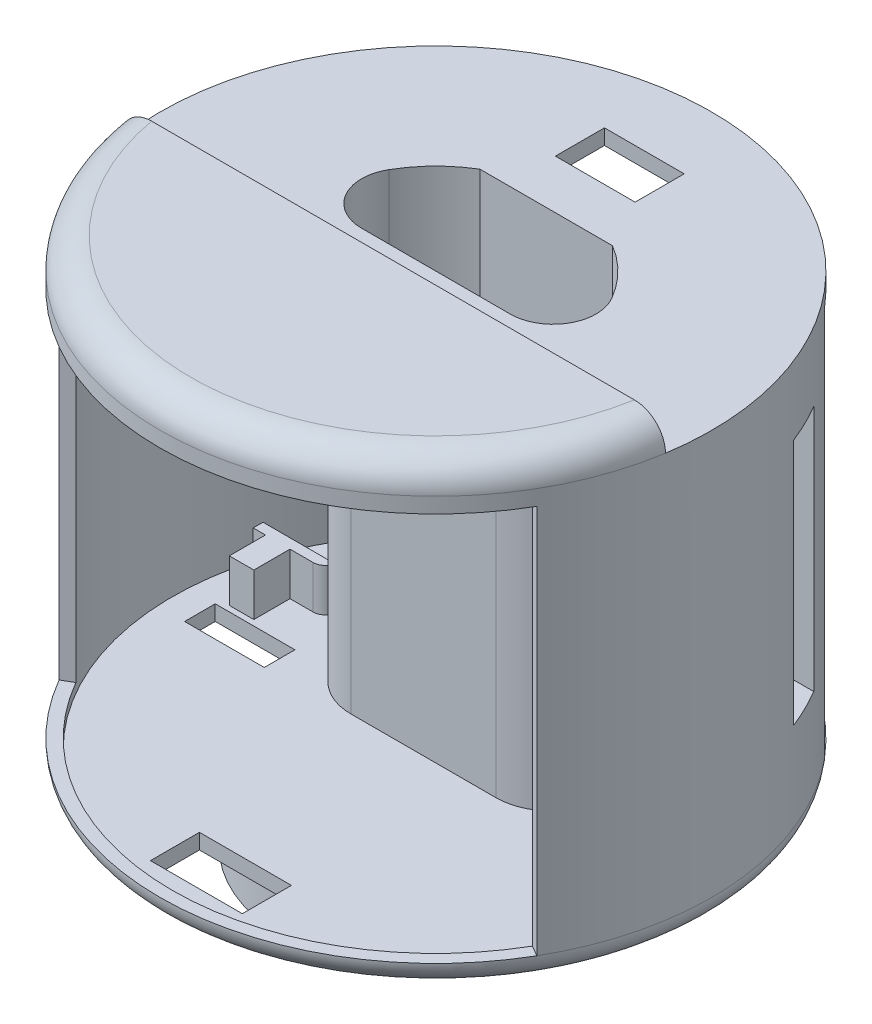
from build123d import *
from build123d.topology import SkipClean

# Parameters (mm, degrees)
CUT_EXTRUDE1_DEPTH           = 5
CUT_EXTRUDE3_DEPTH           = 70
SKETCH8_R                    = 43
CUT_EXTRUDE4_DEPTH           = 65
FILLET1_R                    = 7
SKETCH12_W                   = 6.5
SKETCH12_H                   = 63.5
CUT_REVOLVE1_ANGLE           = 60
CUT_REVOLVE1_OTHER_WAY_ANGLE = 60
SKETCH18_W                   = 13
SKETCH18_H                   = 8
CUT_EXTRUDE13_DEPTH          = 5
SKETCH20_W                   = 100
SKETCH20_H                   = 7
CUT_EXTRUDE15_DEPTH          = 5
SKETCH19_R                   = 1.5
CUT_EXTRUDE14_DEPTH          = 12
FILLET3_R                    = 4
SKETCH24_W                   = 2
SKETCH24_H                   = 3
BOSS_EXTRUDE3_DEPTH          = 2
CIRPATTERN2_COUNT            = 5
SKETCH26_W                   = 5
SKETCH26_H                   = 63.5
CUT_REVOLVE2_ANGLE           = 50
CUT_REVOLVE2_OTHER_WAY_ANGLE = 50
FILLET8_R                    = 9
SKETCH50_W                   = 13
SKETCH50_H                   = 5
CUT_EXTRUDE23_DEPTH          = 7
WRAP1_SECTION_W              = 14
WRAP1_SECTION_H              = 8
WRAP1_ANGLE                  = 29.893450181
SKETCH52_W                   = 21.079035893
SKETCH52_H                   = 8
BOSS_EXTRUDE11_DEPTH         = 7
BOSS_EXTRUDE12_START         = -1
BOSS_EXTRUDE12_OUTLINE_W     = 3
BOSS_EXTRUDE12_OUTLINE_H     = 7
BOSS_EXTRUDE12_DEPTH         = 3
SKETCH54_W                   = 1.6
SKETCH54_H                   = 7
BOSS_EXTRUDE13_DEPTH         = 16
SKETCH55_W                   = 4
SKETCH55_H                   = 7
BOSS_EXTRUDE14_DEPTH         = 6
SKETCH56_W                   = 3
SKETCH56_H                   = 7
CUT_EXTRUDE24_DEPTH          = 1
FILLET9_R                    = 2
SKETCH57_R                   = 1
CUT_EXTRUDE25_DEPTH          = 2
BOSS_EXTRUDE15_START         = 14.3
BOSS_EXTRUDE15_DEPTH         = 3.544129525
BOSS_EXTRUDE15_START_2       = 19.844129625
BOSS_EXTRUDE15_2_DEPTH       = 1.455870375
BOSS_EXTRUDE15_START_3       = 28.5
BOSS_EXTRUDE15_3_DEPTH       = 43.3
BOSS_EXTRUDE15_START_4       = 17.844129525
BOSS_EXTRUDE15_4_DEPTH       = 2.0000001
BOSS_EXTRUDE15_5_DEPTH       = 1.5
BOSS_EXTRUDE15_START_5       = 70.3
BOSS_EXTRUDE15_6_DEPTH       = 1.5
BOSS_EXTRUDE15_START_6       = -10.618295229
BOSS_EXTRUDE15_7_OUTLINE_R   = 1
BOSS_EXTRUDE15_7_DEPTH       = 2
SKETCH63_W                   = 6.5
SKETCH63_H                   = 40.3
CUT_EXTRUDE27_DEPTH          = 10
CUT_EXTRUDE28_DEPTH          = 44
SKETCH67_W                   = 15
SKETCH67_H                   = 8
CUT_EXTRUDE29_DEPTH          = 5


with BuildPart() as part:
    # Sketch1 → Revolve1 (revolve)
    with BuildSketch(Plane.XY, mode=Mode.PRIVATE) as revolve1_sk:
        with BuildLine():
            Line((0, 86.5), (0, 11.5))
            Line((0, 11.5), (22.7, 11.5))
            Line((22.7, 11.5), (22.7, 0))
            Line((22.7, 0), (25, 0))
            Line((25, 0), (25, 11.5))
            Line((25, 11.5), (45, 11.5))
            Line((45, 11.5), (45, 81.5))
            ThreePointArc((45, 81.5), (43.535533906, 85.035533906), (40, 86.5))
            Line((40, 86.5), (0, 86.5))
        make_face()
    revolve(revolve1_sk.sketch.rotate(Axis((0, 2, 0), (0, 1, 0)), 90), axis=Axis((0, 2, 0), (0, 1, 0)))

    # Sketch5 → Cut-Extrude1 (cut)
    with BuildSketch(Plane(origin=(0, 86.5, 0), x_dir=(1, 0, 0), z_dir=(0, 1, 0))):
        with BuildLine():
            Line((-45, 0), (45, 0))
            ThreePointArc((45, 0), (0, 45), (-45, 0))
        make_face()
    extrude(amount=-CUT_EXTRUDE1_DEPTH, mode=Mode.SUBTRACT)

    # Sketch7 → Cut-Extrude3 (cut)
    with BuildSketch(Plane.XZ.offset(-11.5)):
        with BuildLine():
            Line((21, 0), (-21, 0))
            ThreePointArc((-21, 0), (-18.277714988, -10.340461055), (-10.816653826, -18))
            Line((-10.816653826, -18), (10.816653826, -18))
            ThreePointArc((10.816653826, -18), (18.277714988, -10.340461055), (21, 0))
        make_face()
    extrude(amount=-CUT_EXTRUDE3_DEPTH, mode=Mode.SUBTRACT)

    # Sketch8 → Cut-Extrude4 (cut)
    with BuildSketch(Plane(origin=(0, 79, 0), x_dir=(1, 0, 0), z_dir=(0, 1, 0))):
        with Locations(Location((0, 0, 0), (0, 0, 270))):
            Circle(SKETCH8_R)
        with BuildLine():
            Line((22.912878475, -2), (-22.981606036, -2))
            ThreePointArc((-22.981606036, -2), (-20.067855169, 10.855581536), (-10.573881727, 20))
            Line((-10.573881727, 20), (10.505154166, 20))
            ThreePointArc((10.505154166, 20), (19.999127608, 10.855581536), (22.912878475, -2))
        make_face(mode=Mode.SUBTRACT)
    extrude(amount=-CUT_EXTRUDE4_DEPTH, mode=Mode.SUBTRACT)

    # Fillet1
    fillet1_edges = [part.edges().sort_by_distance(p)[0] for p in [
        (-21, 46.5, 0),
        (21, 46.5, 0),
    ]]
    fillet(fillet1_edges, radius=FILLET1_R)

    # Sketch12 → Cut-Revolve1 (revolve, cut)
    with BuildSketch(Plane(origin=(0, 0, 0), x_dir=(0, 0, -1), z_dir=(1, 0, 0))):
        with Locations((-44.75, 47.25)):
            Rectangle(SKETCH12_W, SKETCH12_H)
    revolve(axis=Axis((0, 81.5, 0), (0, -1, 0)), revolution_arc=CUT_REVOLVE1_ANGLE, mode=Mode.SUBTRACT)

    # Sketch12 → Cut-Revolve1 other way (revolve, cut)
    with BuildSketch(Plane(origin=(0, 0, 0), x_dir=(0, 0, -1), z_dir=(1, 0, 0))):
        with Locations((-44.75, 47.25)):
            Rectangle(SKETCH12_W, SKETCH12_H)
    revolve(axis=Axis((0, 81.5, 0), (0, 1, 0)), revolution_arc=CUT_REVOLVE1_OTHER_WAY_ANGLE, mode=Mode.SUBTRACT)

    # Sketch18 → Cut-Extrude13 (cut)
    with BuildSketch(Plane(origin=(0, 81.5, 0), x_dir=(1, 0, 0), z_dir=(0, 1, 0))):
        with Locations((0, 30)):
            Rectangle(SKETCH18_W, SKETCH18_H)
    extrude(amount=-CUT_EXTRUDE13_DEPTH, mode=Mode.SUBTRACT)

    # Sketch20 → Cut-Extrude15 (cut)
    with BuildSketch(Plane(origin=(0, 86.5, 0), x_dir=(1, 0, 0), z_dir=(0, 1, 0))):
        with Locations((0, -3.5)):
            Rectangle(SKETCH20_W, SKETCH20_H)
    extrude(amount=-CUT_EXTRUDE15_DEPTH, mode=Mode.SUBTRACT)

    # Sketch19 → Cut-Extrude14 (cut)
    with BuildSketch(Plane(origin=(0, 0, 7), x_dir=(-1, 0, 0), z_dir=(0, 0, -1))):
        with Locations((0, 84)):
            Circle(SKETCH19_R)
        with Locations((-30, 84)):
            Circle(SKETCH19_R)
        with Locations((29.452221542, 84)):
            Circle(SKETCH19_R)
    extrude(amount=-CUT_EXTRUDE14_DEPTH, mode=Mode.SUBTRACT)

    # Fillet3
    fillet3_edges = [part.edges().sort_by_distance(p)[0] for p in [
        (0, 11.5, 45),
    ]]
    fillet(fillet3_edges, radius=FILLET3_R - 0.0001)  # a hair under: the kernel refuses the full size

    # Sketch24 → Boss-Extrude3 (add)
    with BuildSketch(Plane.XZ):
        with Locations((0, -22.7)):
            Rectangle(SKETCH24_W, SKETCH24_H)
    boss_extrude3 = extrude(amount=-BOSS_EXTRUDE3_DEPTH)

    # CirPattern2: Boss-Extrude3 ×5 about axis
    cirpattern2_axis = Axis((0, 0, 0), (0, 1, 0))
    for i in range(1, CIRPATTERN2_COUNT):
        add(boss_extrude3.rotate(cirpattern2_axis, i * 360 / CIRPATTERN2_COUNT))

    # Sketch26 → Cut-Revolve2 (revolve, cut)
    with BuildSketch(Plane(origin=(0, 0, 0), x_dir=(0, 0, -1), z_dir=(1, 0, 0))):
        with Locations((45.056943441, 47.25)):
            Rectangle(SKETCH26_W, SKETCH26_H)
    revolve(axis=Axis((0, 2, 0), (0, -1, 0)), revolution_arc=CUT_REVOLVE2_ANGLE, mode=Mode.SUBTRACT)

    # Sketch26 → Cut-Revolve2 other way (revolve, cut)
    with BuildSketch(Plane(origin=(0, 0, 0), x_dir=(0, 0, -1), z_dir=(1, 0, 0))):
        with Locations((45.056943441, 47.25)):
            Rectangle(SKETCH26_W, SKETCH26_H)
    revolve(axis=Axis((0, 2, 0), (0, 1, 0)), revolution_arc=CUT_REVOLVE2_OTHER_WAY_ANGLE, mode=Mode.SUBTRACT)

    # Fillet8
    fillet8_edges = [part.edges().sort_by_distance(p)[0] for p in [
        (-22.981606036, 46.5, 2),
        (22.912878475, 46.5, 2),
    ]]
    fillet(fillet8_edges, radius=FILLET8_R)

    # Sketch50 → Cut-Extrude23 (cut)
    with BuildSketch(Plane(origin=(0, 14, 0), x_dir=(1, 0, 0), z_dir=(0, 1, 0))):
        with Locations((32, 0)):
            Rectangle(SKETCH50_W, SKETCH50_H)
        with Locations((-32, 0)):
            Rectangle(SKETCH50_W, SKETCH50_H)
    extrude(amount=-CUT_EXTRUDE23_DEPTH, mode=Mode.SUBTRACT)

    # Wrap1 section (on wrap section) → Wrap1 (revolve)
    with BuildSketch(Plane(origin=(-0.03436378, 79, 0.443056559), x_dir=(0.8417807911855657, 0, -0.5398195064936087), z_dir=(0.5398195064936087, 0, 0.8417807911855657))):
        with Locations((30, -61)):
            Rectangle(WRAP1_SECTION_W, WRAP1_SECTION_H)
    wrap1 = revolve(axis=Axis((-0.03436378, 79, 0.443056559), (0, 1, 0)), revolution_arc=WRAP1_ANGLE)

    # Mirror3: Wrap1 across plane
    add(wrap1.mirror(Plane(origin=(0, 0, 0), x_dir=(0, 0, 1), z_dir=(1, 0, 0))))

    # Sketch52 → Boss-Extrude11 (add)
    with BuildSketch(Plane(origin=(0, 0, -20), x_dir=(-1, 0, 0), z_dir=(0, 0, -1))):
        with Locations((0.03436378, 18)):
            Rectangle(SKETCH52_W, SKETCH52_H)
    extrude(amount=BOSS_EXTRUDE11_DEPTH)



with BuildPart() as body_2:
    # Boss-Extrude12: read off the stored shape, not the designer's step
    # Boss-Extrude12 outline → Boss-Extrude12 (new body)
    with BuildSketch(Plane(origin=(20.823161639, 0, 0), x_dir=(0, 0, -1), z_dir=(1, 0, 0)).offset(BOSS_EXTRUDE12_START)):
        with Locations((9.818295229, 17.8)):
            Rectangle(BOSS_EXTRUDE12_OUTLINE_W, BOSS_EXTRUDE12_OUTLINE_H)
    extrude(amount=BOSS_EXTRUDE12_DEPTH)


with BuildPart() as part_1:
    add(part.part)

    add(body_2.part)  # Boss-Extrude13 merges body 2
    # Sketch54 → Boss-Extrude13 (add)
    with BuildSketch(Plane(origin=(22.823161639, 0, 0), x_dir=(0, 0, -1), z_dir=(1, 0, 0))):
        with Locations((9.818295229, 17.8)):
            Rectangle(SKETCH54_W, SKETCH54_H)
    extrude(amount=BOSS_EXTRUDE13_DEPTH)

    # Sketch55 → Boss-Extrude14 (add)
    with BuildSketch(Plane.XY.offset(-9.118295229)):
        with Locations((34.823161639, 17.8)):
            Rectangle(SKETCH55_W, SKETCH55_H)
    extrude(amount=BOSS_EXTRUDE14_DEPTH)

    # Sketch56 → Cut-Extrude24 (cut)
    with BuildSketch(Plane.XY.offset(-9.018295229)):
        with Locations((25.823161639, 17.8)):
            Rectangle(SKETCH56_W, SKETCH56_H)
    extrude(amount=-CUT_EXTRUDE24_DEPTH, mode=Mode.SUBTRACT)

    # Fillet9
    # the kernel refuses this fillet: 2 mm, written as the material it takes off along each edge
    with BuildSketch(Plane(origin=(27.323161639, 25.630127019, -9.018295229), x_dir=(1, 0, 0), z_dir=(0, -1, 0))) as fillet9_piece_1_section:
        with BuildLine():
            CenterArc((1.732050808, -2), FILLET9_R, 90, 60)
            Line((0, -1), (0, 0))
            Line((0, 0), (1.732050808, 0))
        make_face()
    fillet9_piece_1 = extrude(amount=15.660254038, mode=Mode.PRIVATE)
    fillet9_piece_1 = split(fillet9_piece_1, bisect_by=Plane(origin=(27.323161639, 14, -9.018295229), z_dir=(0, 1, 0)), keep=Keep.TOP, mode=Mode.PRIVATE)
    add(fillet9_piece_1, mode=Mode.SUBTRACT)

    # Sketch57 → Cut-Extrude25 (cut)
    with BuildSketch(Plane(origin=(0, 0, -10.618295229), x_dir=(-1, 0, 0), z_dir=(0, 0, -1))):
        with Locations(Location((-36.823161639, 18.844129625, 0), (0, 0, 90))):
            Circle(SKETCH57_R)
    extrude(amount=-CUT_EXTRUDE25_DEPTH, mode=Mode.SUBTRACT)

    # Boss-Extrude15: read off the stored shape, not the designer's step
    # Boss-Extrude15 outline → Boss-Extrude15 (add)
    with BuildSketch(Plane(origin=(0, 0, 0), x_dir=(1, 0, 0), z_dir=(0, 1, 0)).offset(BOSS_EXTRUDE15_START)):
        with BuildLine():
            Line((-32.823161639, 9.018295229), (-29.055212446, 9.018295229))
            ThreePointArc((-29.055212446, 9.018295229), (-28.055212446, 9.286244421), (-27.323161639, 10.018295229))
            Line((-27.323161639, 10.018295229), (-24.323161639, 10.018295229))
            Line((-24.323161639, 10.018295229), (-24.323161639, 9.018295229))
            Line((-24.323161639, 9.018295229), (-22.823161639, 9.018295229))
            Line((-22.823161639, 9.018295229), (-22.823161639, 8.318295229))
            Line((-22.823161639, 8.318295229), (-20.794815555, 8.318295229))
            ThreePointArc((-20.794815555, 8.318295229), (-20.436002794, 9.828095276), (-19.823161639, 11.253812113))
            Line((-19.823161639, 11.253812113), (-19.823161639, 11.318295229))
            Line((-19.823161639, 11.318295229), (-22.823161639, 11.318295229))
            Line((-22.823161639, 11.318295229), (-22.823161639, 10.618295229))
            Line((-22.823161639, 10.618295229), (-38.823161639, 10.618295229))
            Line((-38.823161639, 10.618295229), (-38.823161639, 9.018295229))
            Line((-38.823161639, 9.018295229), (-36.823161639, 9.018295229))
            Line((-36.823161639, 9.018295229), (-36.823161639, 8.618295229))
            Line((-36.823161639, 8.618295229), (-36.823161639, 3.118295229))
            Line((-36.823161639, 3.118295229), (-32.823161639, 3.118295229))
            Line((-32.823161639, 3.118295229), (-32.823161639, 9.018295229))
        make_face()
    extrude(amount=BOSS_EXTRUDE15_DEPTH)

    # Boss-Extrude15 2 outline → Boss-Extrude15 2 (add)
    with BuildSketch(Plane(origin=(0, 0, 0), x_dir=(1, 0, 0), z_dir=(0, 1, 0)).offset(BOSS_EXTRUDE15_START_2)):
        with BuildLine():
            Line((-32.823161639, 9.018295229), (-29.055212446, 9.018295229))
            ThreePointArc((-29.055212446, 9.018295229), (-28.055212446, 9.286244421), (-27.323161639, 10.018295229))
            Line((-27.323161639, 10.018295229), (-24.323161639, 10.018295229))
            Line((-24.323161639, 10.018295229), (-24.323161639, 9.018295229))
            Line((-24.323161639, 9.018295229), (-22.823161639, 9.018295229))
            Line((-22.823161639, 9.018295229), (-22.823161639, 8.318295229))
            Line((-22.823161639, 8.318295229), (-20.794815555, 8.318295229))
            ThreePointArc((-20.794815555, 8.318295229), (-20.436002794, 9.828095276), (-19.823161639, 11.253812113))
            Line((-19.823161639, 11.253812113), (-19.823161639, 11.318295229))
            Line((-19.823161639, 11.318295229), (-22.823161639, 11.318295229))
            Line((-22.823161639, 11.318295229), (-22.823161639, 10.618295229))
            Line((-22.823161639, 10.618295229), (-38.823161639, 10.618295229))
            Line((-38.823161639, 10.618295229), (-38.823161639, 9.018295229))
            Line((-38.823161639, 9.018295229), (-36.823161639, 9.018295229))
            Line((-36.823161639, 9.018295229), (-36.823161639, 8.618295229))
            Line((-36.823161639, 8.618295229), (-36.823161639, 3.118295229))
            Line((-36.823161639, 3.118295229), (-32.823161639, 3.118295229))
            Line((-32.823161639, 3.118295229), (-32.823161639, 9.018295229))
        make_face()
    extrude(amount=BOSS_EXTRUDE15_2_DEPTH)

    # Boss-Extrude15 3 outline → Boss-Extrude15 3 (add)
    with BuildSketch(Plane(origin=(0, 0, 0), x_dir=(1, 0, 0), z_dir=(0, 1, 0)).offset(BOSS_EXTRUDE15_START_3)):
        with BuildLine():
            ThreePointArc((37.794149836, 24.425442436), (38.265624448, 23.67999125), (38.722397771, 22.925442436))
            Line((38.722397771, 22.925442436), (45, 22.925442436))
            Line((45, 22.925442436), (45, 24.425442436))
            Line((45, 24.425442436), (37.794149836, 24.425442436))
        make_face()
        with BuildLine():
            Line((45, 16.425442436), (41.895164886, 16.425442436))
            ThreePointArc((41.895164886, 16.425442436), (42.180597376, 15.677920941), (42.452693296, 14.925442436))
            Line((42.452693296, 14.925442436), (45, 14.925442436))
            Line((45, 14.925442436), (45, 16.425442436))
        make_face()
        with BuildLine():
            Line((35, 24.425442436), (35, 22.925442436))
            Line((35, 22.925442436), (36.378896205, 22.925442436))
            ThreePointArc((36.378896205, 22.925442436), (35.891901131, 23.680613024), (35.389232286, 24.425442436))
            Line((35.389232286, 24.425442436), (35, 24.425442436))
        make_face()
        with BuildLine():
            Line((39.739210369, 16.425442436), (35, 16.425442436))
            Line((35, 16.425442436), (35, 14.925442436))
            Line((35, 14.925442436), (40.326556611, 14.925442436))
            ThreePointArc((40.326556611, 14.925442436), (40.039908348, 15.678193119), (39.739210369, 16.425442436))
        make_face()
    extrude(amount=BOSS_EXTRUDE15_3_DEPTH)

    # Boss-Extrude15 4 outline → Boss-Extrude15 4 (add)
    with BuildSketch(Plane(origin=(0, 0, 0), x_dir=(1, 0, 0), z_dir=(0, 1, 0)).offset(BOSS_EXTRUDE15_START_4)):
        with BuildLine():
            Line((-32.823161639, 9.018295229), (-29.055212446, 9.018295229))
            ThreePointArc((-29.055212446, 9.018295229), (-28.055212446, 9.286244421), (-27.323161639, 10.018295229))
            Line((-27.323161639, 10.018295229), (-24.323161639, 10.018295229))
            Line((-24.323161639, 10.018295229), (-24.323161639, 9.018295229))
            Line((-24.323161639, 9.018295229), (-22.823161639, 9.018295229))
            Line((-22.823161639, 9.018295229), (-22.823161639, 8.318295229))
            Line((-22.823161639, 8.318295229), (-20.794815555, 8.318295229))
            ThreePointArc((-20.794815555, 8.318295229), (-20.436002794, 9.828095276), (-19.823161639, 11.253812113))
            Line((-19.823161639, 11.253812113), (-19.823161639, 11.318295229))
            Line((-19.823161639, 11.318295229), (-22.823161639, 11.318295229))
            Line((-22.823161639, 11.318295229), (-22.823161639, 10.618295229))
            Line((-22.823161639, 10.618295229), (-38.823161639, 10.618295229))
            Line((-38.823161639, 10.618295229), (-38.823161639, 9.018295229))
            Line((-38.823161639, 9.018295229), (-36.823161639, 9.018295229))
            Line((-36.823161639, 9.018295229), (-36.823161639, 8.618295229))
            Line((-36.823161639, 8.618295229), (-36.823161639, 3.118295229))
            Line((-36.823161639, 3.118295229), (-32.823161639, 3.118295229))
            Line((-32.823161639, 3.118295229), (-32.823161639, 9.018295229))
        make_face()
    extrude(amount=BOSS_EXTRUDE15_4_DEPTH)

    # Boss-Extrude15 5 outline → Boss-Extrude15 5 (add)
    with BuildSketch(Plane(origin=(0, 0, 0), x_dir=(1, 0, 0), z_dir=(0, 1, 0)).offset(BOSS_EXTRUDE15_START_3)):
        with BuildLine():
            Line((45, 22.925442436), (38.722397771, 22.925442436))
            ThreePointArc((38.722397771, 22.925442436), (40.439588922, 19.739291979), (41.895164886, 16.425442436))
            Line((41.895164886, 16.425442436), (45, 16.425442436))
            Line((45, 16.425442436), (45, 22.925442436))
        make_face()
        with BuildLine():
            Line((36.378896205, 22.925442436), (35, 22.925442436))
            Line((35, 22.925442436), (35, 16.425442436))
            Line((35, 16.425442436), (39.739210369, 16.425442436))
            ThreePointArc((39.739210369, 16.425442436), (38.197565853, 19.747049473), (36.378896205, 22.925442436))
        make_face()
    extrude(amount=BOSS_EXTRUDE15_5_DEPTH)

    # Boss-Extrude15 6 outline → Boss-Extrude15 6 (add)
    with BuildSketch(Plane(origin=(0, 0, 0), x_dir=(1, 0, 0), z_dir=(0, 1, 0)).offset(BOSS_EXTRUDE15_START_5)):
        with BuildLine():
            Line((45, 22.925442436), (38.722397771, 22.925442436))
            ThreePointArc((38.722397771, 22.925442436), (40.439588922, 19.739291979), (41.895164886, 16.425442436))
            Line((41.895164886, 16.425442436), (45, 16.425442436))
            Line((45, 16.425442436), (45, 22.925442436))
        make_face()
        with BuildLine():
            Line((36.378896205, 22.925442436), (35, 22.925442436))
            Line((35, 22.925442436), (35, 16.425442436))
            Line((35, 16.425442436), (39.739210369, 16.425442436))
            ThreePointArc((39.739210369, 16.425442436), (38.197565853, 19.747049473), (36.378896205, 22.925442436))
        make_face()
    extrude(amount=BOSS_EXTRUDE15_6_DEPTH)

    # Boss-Extrude15 7 outline → Boss-Extrude15 7 (cut)
    with BuildSketch(Plane.XY.offset(BOSS_EXTRUDE15_START_6)):
        with Locations((-36.823161639, 18.844129625)):
            Circle(BOSS_EXTRUDE15_7_OUTLINE_R)
    extrude(amount=BOSS_EXTRUDE15_7_DEPTH, mode=Mode.SUBTRACT)

    # Sketch63 → Cut-Extrude27 (cut)
    with BuildSketch(Plane(origin=(45, 0, 0), x_dir=(0, 0, -1), z_dir=(1, 0, 0))):
        with Locations((19.675442436, 50.15)):
            Rectangle(SKETCH63_W, SKETCH63_H)
    extrude(amount=-CUT_EXTRUDE27_DEPTH, mode=Mode.SUBTRACT)

    # Sketch66 → Cut-Extrude28 (cut)
    with SkipClean():  # the faces are left unmerged after this step: merging them gives an invalid solid
        with BuildSketch(Plane(origin=(0, 71.8, 0), x_dir=(1, 0, 0), z_dir=(0, 1, 0))):
            with BuildLine():
                Line((42.452693296, 14.925442436), (45, 14.925442436))
                Line((45, 14.925442436), (45, 24.425442436))
                Line((45, 24.425442436), (37.794149836, 24.425442436))
                ThreePointArc((37.794149836, 24.425442436), (40.403606994, 19.812837804), (42.452693296, 14.925442436))
            make_face()
        extrude(amount=-CUT_EXTRUDE28_DEPTH, mode=Mode.SUBTRACT)

    # Sketch67 → Cut-Extrude29 (cut)
    with SkipClean():  # the faces are left unmerged after this step: merging them gives an invalid solid
        with BuildSketch(Plane.XZ.offset(-11.5)):
            with Locations((0, 35.077013509)):
                Rectangle(SKETCH67_W, SKETCH67_H)
        extrude(amount=-CUT_EXTRUDE29_DEPTH, mode=Mode.SUBTRACT)


solid = part_1.part
